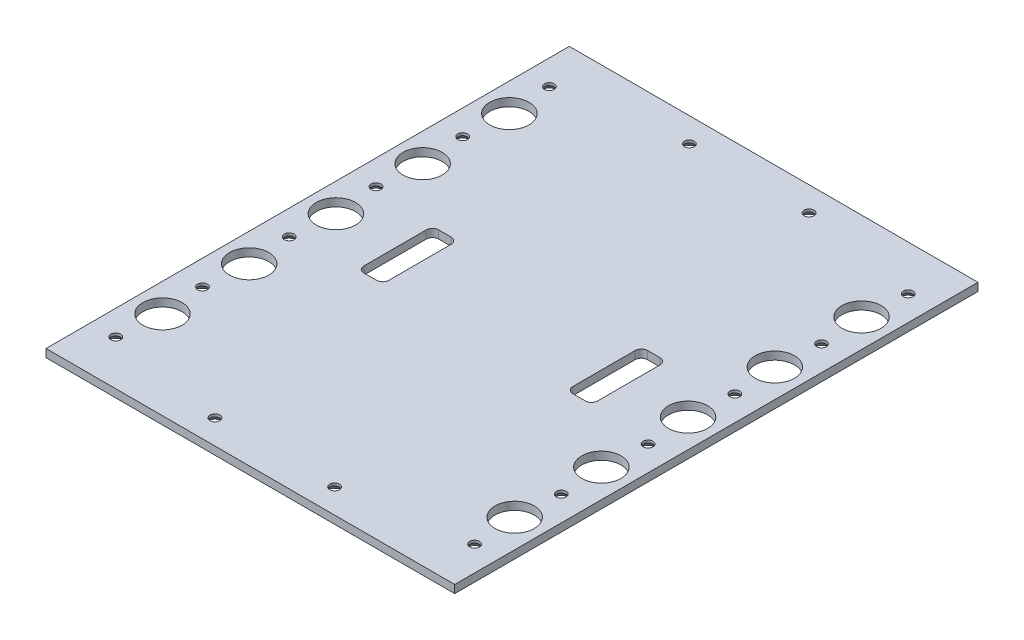
from build123d import *

# Parameters (mm, degrees)
SKETCH1_W                                    = 208.28
SKETCH1_H                                    = 266.7
BOSS_EXTRUDE1_DEPTH                          = 4.064
SKETCH2_W                                    = 12.7
SKETCH2_H                                    = 38.1
CUT_EXTRUDE1_DEPTH                           = 170.24502414
FILLET1_R                                    = 3.175
SKETCH3_R                                    = 10
CUT_EXTRUDE2_DEPTH                           = 170.24502414
CSK_FOR_10_FLAT_HEAD_MACHINE_SCREW2_AT_COUNT = 2
CSK_FOR_10_FLAT_HEAD_MACHINE_SCREW2_AT_PITCH = 220.98
CSK_FOR_10_FLAT_HEAD_MACHINE_SCREW2_2_COUNT  = 2
CSK_FOR_10_FLAT_HEAD_MACHINE_SCREW2_2_PITCH  = 176.784
CSK_FOR_10_FLAT_HEAD_MACHINE_SCREW2_3_COUNT  = 2
CSK_FOR_10_FLAT_HEAD_MACHINE_SCREW2_3_PITCH  = 132.588
CSK_FOR_10_FLAT_HEAD_MACHINE_SCREW2_4_COUNT  = 2
CSK_FOR_10_FLAT_HEAD_MACHINE_SCREW2_4_PITCH  = 88.392
CSK_FOR_10_FLAT_HEAD_MACHINE_SCREW2_5_COUNT  = 2
CSK_FOR_10_FLAT_HEAD_MACHINE_SCREW2_5_PITCH  = 44.196
CSK_FOR_10_FLAT_HEAD_MACHINE_SCREW2_6_COUNT  = 2
CSK_FOR_10_FLAT_HEAD_MACHINE_SCREW2_6_PITCH  = 239.289165731
CSK_FOR_10_FLAT_HEAD_MACHINE_SCREW2_7_COUNT  = 2
CSK_FOR_10_FLAT_HEAD_MACHINE_SCREW2_7_PITCH  = 61.843132165


with BuildPart() as part:
    # Sketch1 → Boss-Extrude1 (new body)
    with BuildSketch(Plane(origin=(0, 0, 0), x_dir=(1, 0, 0), z_dir=(0, 1, 0))):
        Rectangle(SKETCH1_W, SKETCH1_H)
    extrude(amount=BOSS_EXTRUDE1_DEPTH)

    # Sketch2 → Cut-Extrude1 (cut, through all)
    with BuildSketch(Plane(origin=(0, 4.064, 0), x_dir=(1, 0, 0), z_dir=(0, 1, 0))):
        with Locations((-53.2265001, 0)):
            Rectangle(SKETCH2_W, SKETCH2_H)
    cut_extrude1 = extrude(amount=-CUT_EXTRUDE1_DEPTH, mode=Mode.SUBTRACT)

    # Mirror1: Cut-Extrude1 across plane
    add(cut_extrude1.mirror(Plane(origin=(0, 0, 0), x_dir=(0, 0, 1), z_dir=(1, 0, 0))), mode=Mode.SUBTRACT)

    # Fillet1
    fillet1_edges = [part.edges().sort_by_distance(p)[0] for p in [
        (59.5765001, 2.032, 19.05),
        (46.8765001, 2.032, 19.05),
        (59.5765001, 2.032, -19.05),
        (46.8765001, 2.032, -19.05),
        (-46.8765001, 2.032, 19.05),
        (-59.5765001, 2.032, 19.05),
        (-46.8765001, 2.032, -19.05),
        (-59.5765001, 2.032, -19.05),
    ]]
    fillet(fillet1_edges, radius=FILLET1_R)

    # Sketch3 → Cut-Extrude2 (cut, through all)
    with BuildSketch(Plane(origin=(0, 0, 0), x_dir=(1, 0, 0), z_dir=(0, 1, 0))):
        with Locations((-89.74, 88.392)):
            Circle(SKETCH3_R)
        with Locations((-89.74, 44.196)):
            Circle(SKETCH3_R)
        with Locations((-89.74, 0)):
            Circle(SKETCH3_R)
        with Locations((-89.74, -44.196)):
            Circle(SKETCH3_R)
        with Locations((-89.74, -88.392)):
            Circle(SKETCH3_R)
    cut_extrude2 = extrude(amount=CUT_EXTRUDE2_DEPTH, mode=Mode.SUBTRACT)

    # Sketch10 → CSK for #10 Flat Head Machine Screw2 (revolve, cut)
    with BuildSketch(Plane(origin=(-91.44, 0, -110.49), x_dir=(0, 0, -1), z_dir=(1, 0, 0))):
        Polygon((0, 0), (0, 12.417662253), (2.4892, 10.922), (2.4892, 2.761229288), (4.8895, 0), align=None)
    csk_for_10_flat_head_machine_screw2 = revolve(axis=Axis((-91.44, -6.35, -110.49), (0, 1, 0)), mode=Mode.SUBTRACT)

    # CSK for #10 Flat Head Machine Screw2 at: CSK for #10 Flat Head Machine Screw2 ×2
    with Locations(*[(0, 0, i * CSK_FOR_10_FLAT_HEAD_MACHINE_SCREW2_AT_PITCH) for i in range(1, CSK_FOR_10_FLAT_HEAD_MACHINE_SCREW2_AT_COUNT)]):
        add(csk_for_10_flat_head_machine_screw2, mode=Mode.SUBTRACT)

    # CSK for _10 Flat Head Machine Screw2 2: CSK for #10 Flat Head Machine Screw2 ×2
    with Locations(*[(0, 0, i * CSK_FOR_10_FLAT_HEAD_MACHINE_SCREW2_2_PITCH) for i in range(1, CSK_FOR_10_FLAT_HEAD_MACHINE_SCREW2_2_COUNT)]):
        add(csk_for_10_flat_head_machine_screw2, mode=Mode.SUBTRACT)

    # CSK for _10 Flat Head Machine Screw2 3: CSK for #10 Flat Head Machine Screw2 ×2
    with Locations(*[(0, 0, i * CSK_FOR_10_FLAT_HEAD_MACHINE_SCREW2_3_PITCH) for i in range(1, CSK_FOR_10_FLAT_HEAD_MACHINE_SCREW2_3_COUNT)]):
        add(csk_for_10_flat_head_machine_screw2, mode=Mode.SUBTRACT)

    # CSK for _10 Flat Head Machine Screw2 4: CSK for #10 Flat Head Machine Screw2 ×2
    with Locations(*[(0, 0, i * CSK_FOR_10_FLAT_HEAD_MACHINE_SCREW2_4_PITCH) for i in range(1, CSK_FOR_10_FLAT_HEAD_MACHINE_SCREW2_4_COUNT)]):
        add(csk_for_10_flat_head_machine_screw2, mode=Mode.SUBTRACT)

    # CSK for _10 Flat Head Machine Screw2 5: CSK for #10 Flat Head Machine Screw2 ×2
    with Locations(*[(0, 0, i * CSK_FOR_10_FLAT_HEAD_MACHINE_SCREW2_5_PITCH) for i in range(1, CSK_FOR_10_FLAT_HEAD_MACHINE_SCREW2_5_COUNT)]):
        add(csk_for_10_flat_head_machine_screw2, mode=Mode.SUBTRACT)

    # CSK for _10 Flat Head Machine Screw2 6: CSK for #10 Flat Head Machine Screw2 ×2
    with Locations(*[Vector(0.25475453438897305, 0, 0.9670057534514764) * (i * CSK_FOR_10_FLAT_HEAD_MACHINE_SCREW2_6_PITCH) for i in range(1, CSK_FOR_10_FLAT_HEAD_MACHINE_SCREW2_6_COUNT)]):
        add(csk_for_10_flat_head_machine_screw2, mode=Mode.SUBTRACT)

    # CSK for _10 Flat Head Machine Screw2 7: CSK for #10 Flat Head Machine Screw2 ×2
    with Locations(*[Vector(0.9857198021144562, 0, -0.16839379952788436) * (i * CSK_FOR_10_FLAT_HEAD_MACHINE_SCREW2_7_PITCH) for i in range(1, CSK_FOR_10_FLAT_HEAD_MACHINE_SCREW2_7_COUNT)]):
        add(csk_for_10_flat_head_machine_screw2, mode=Mode.SUBTRACT)

    # Mirror2: Cut-Extrude2, CSK for #10 Flat Head Machine Screw2 across plane
    add(cut_extrude2.mirror(Plane(origin=(0, 0, 0), x_dir=(0, 0, 1), z_dir=(1, 0, 0))), mode=Mode.SUBTRACT)
    add(csk_for_10_flat_head_machine_screw2.mirror(Plane(origin=(0, 0, 0), x_dir=(0, 0, 1), z_dir=(1, 0, 0))), mode=Mode.SUBTRACT)

    # Mirror2 copy 1 sketch → Mirror2 copy 1 (revolve, cut)
    with BuildSketch(Plane(origin=(91.44, 0, 110.49), x_dir=(0, 0, -1), z_dir=(-1, 0, 0))):
        Polygon((0, 0), (0, -12.417662253), (2.4892, -10.922), (2.4892, -2.761229288), (4.8895, 0), align=None)
    revolve(axis=Axis((91.44, -6.35, 110.49), (0, -1, 0)), mode=Mode.SUBTRACT)

    # Mirror2 copy 2 sketch → Mirror2 copy 2 (revolve, cut)
    with BuildSketch(Plane(origin=(91.44, 0, 66.294), x_dir=(0, 0, -1), z_dir=(-1, 0, 0))):
        Polygon((0, 0), (0, -12.417662253), (2.4892, -10.922), (2.4892, -2.761229288), (4.8895, 0), align=None)
    revolve(axis=Axis((91.44, -6.35, 66.294), (0, -1, 0)), mode=Mode.SUBTRACT)

    # Mirror2 copy 3 sketch → Mirror2 copy 3 (revolve, cut)
    with BuildSketch(Plane(origin=(91.44, 0, 22.098), x_dir=(0, 0, -1), z_dir=(-1, 0, 0))):
        Polygon((0, 0), (0, -12.417662253), (2.4892, -10.922), (2.4892, -2.761229288), (4.8895, 0), align=None)
    revolve(axis=Axis((91.44, -6.35, 22.098), (0, -1, 0)), mode=Mode.SUBTRACT)

    # Mirror2 copy 4 sketch → Mirror2 copy 4 (revolve, cut)
    with BuildSketch(Plane(origin=(91.44, 0, -22.098), x_dir=(0, 0, -1), z_dir=(-1, 0, 0))):
        Polygon((0, 0), (0, -12.417662253), (2.4892, -10.922), (2.4892, -2.761229288), (4.8895, 0), align=None)
    revolve(axis=Axis((91.44, -6.35, -22.098), (0, -1, 0)), mode=Mode.SUBTRACT)

    # Mirror2 copy 5 sketch → Mirror2 copy 5 (revolve, cut)
    with BuildSketch(Plane(origin=(91.44, 0, -66.294), x_dir=(0, 0, -1), z_dir=(-1, 0, 0))):
        Polygon((0, 0), (0, -12.417662253), (2.4892, -10.922), (2.4892, -2.761229288), (4.8895, 0), align=None)
    revolve(axis=Axis((91.44, -6.35, -66.294), (0, -1, 0)), mode=Mode.SUBTRACT)

    # Mirror2 copy 6 sketch → Mirror2 copy 6 (revolve, cut)
    with BuildSketch(Plane(origin=(30.48, 0, 120.904), x_dir=(0, 0, -1), z_dir=(-1, 0, 0))):
        Polygon((0, 0), (0, -12.417662253), (2.4892, -10.922), (2.4892, -2.761229288), (4.8895, 0), align=None)
    revolve(axis=Axis((30.48, -6.35, 120.904), (0, -1, 0)), mode=Mode.SUBTRACT)

    # Mirror2 copy 7 sketch → Mirror2 copy 7 (revolve, cut)
    with BuildSketch(Plane(origin=(30.48, 0, -120.904), x_dir=(0, 0, -1), z_dir=(-1, 0, 0))):
        Polygon((0, 0), (0, -12.417662253), (2.4892, -10.922), (2.4892, -2.761229288), (4.8895, 0), align=None)
    revolve(axis=Axis((30.48, -6.35, -120.904), (0, -1, 0)), mode=Mode.SUBTRACT)


solid = part.part
